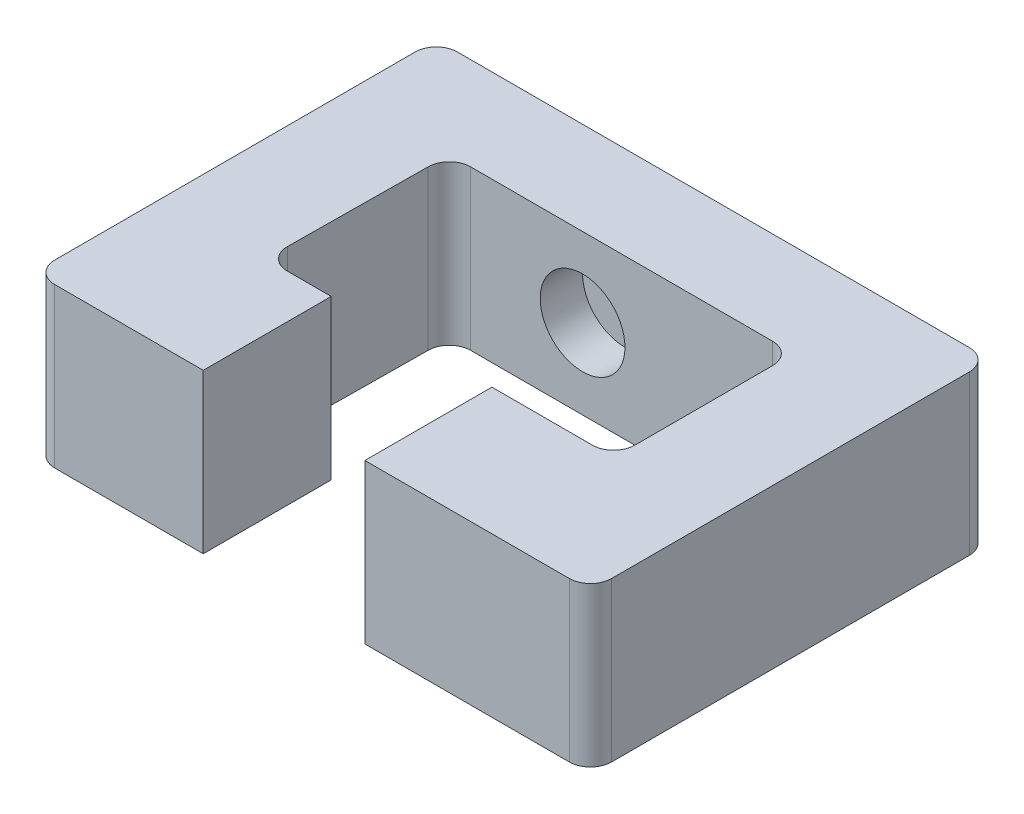
from build123d import *

# Parameters (mm, degrees)
EXTRUDE_1_DEPTH     = 15
SKETCH_4_R          = 4
CUT_EXTRUDE_4_DEPTH = 4
SKETCH_5_R          = 1.5
CUT_EXTRUDE_5_DEPTH = 6


with BuildPart() as part:
    # 草图1 → 凸台-拉伸1 (new body)
    with BuildSketch(Plane(origin=(0, 0, 0), x_dir=(1, 0, 0), z_dir=(0, 1, 0))):
        with BuildLine():
            Line((-39.00747428, -18.440503175), (-39.00747428, 15.570006417))
            ThreePointArc((-39.00747428, 15.570006417), (-38.421687843, 16.98421998), (-37.00747428, 17.570006417))
            Line((-37.00747428, 17.570006417), (11.297453859, 17.570006417))
            ThreePointArc((11.297453859, 17.570006417), (12.711667422, 16.98421998), (13.297453859, 15.570006417))
            Line((13.297453859, 15.570006417), (13.297453859, -18.184070864))
            ThreePointArc((13.297453859, -18.184070864), (12.711667422, -19.598284426), (11.297453859, -20.184070864))
            Line((11.297453859, -20.184070864), (3.297453859, -20.184070864))
            Line((3.297453859, -20.184070864), (-7.990187931, -20.184070864))
            Line((-7.990187931, -20.184070864), (-7.990187931, -8.196688786))
            Line((-7.990187931, -8.196688786), (1.497576962, -8.196688786))
            ThreePointArc((1.497576962, -8.196688786), (2.911790524, -7.610902349), (3.497576962, -6.196688786))
            Line((3.497576962, -6.196688786), (3.497576962, 6.805372025))
            ThreePointArc((3.497576962, 6.805372025), (2.911790524, 8.219585587), (1.497576962, 8.805372025))
            Line((1.497576962, 8.805372025), (-27.00747428, 8.805372025))
            ThreePointArc((-27.00747428, 8.805372025), (-28.421687843, 8.219585587), (-29.00747428, 6.805372025))
            Line((-29.00747428, 6.805372025), (-29.132089063, -6.348210662))
            ThreePointArc((-29.132089063, -6.348210662), (-28.55307529, -7.774656382), (-27.13217881, -8.367157468))
            Line((-27.13217881, -8.367157468), (-22.990187931, -8.367157468))
            Line((-22.990187931, -8.367157468), (-22.990187931, -20.440503175))
            Line((-22.990187931, -20.440503175), (-37.00747428, -20.440503175))
            ThreePointArc((-37.00747428, -20.440503175), (-38.421687843, -19.854716738), (-39.00747428, -18.440503175))
        make_face()
    extrude(amount=EXTRUDE_1_DEPTH)

    # 草图4 → 切除-拉伸4 (cut)
    with BuildSketch(Plane.XY.offset(-8.805372025)):
        with Locations((-16.433674541, 7.535252011)):
            Circle(SKETCH_4_R)
    extrude(amount=-CUT_EXTRUDE_4_DEPTH, mode=Mode.SUBTRACT)

    # 草图5 → 切除-拉伸5 (cut)
    with BuildSketch(Plane.XY.offset(-12.805372025)):
        with Locations((-16.39151054, 7.589335744)):
            Circle(SKETCH_5_R)
    extrude(amount=-CUT_EXTRUDE_5_DEPTH, mode=Mode.SUBTRACT)


solid = part.part
